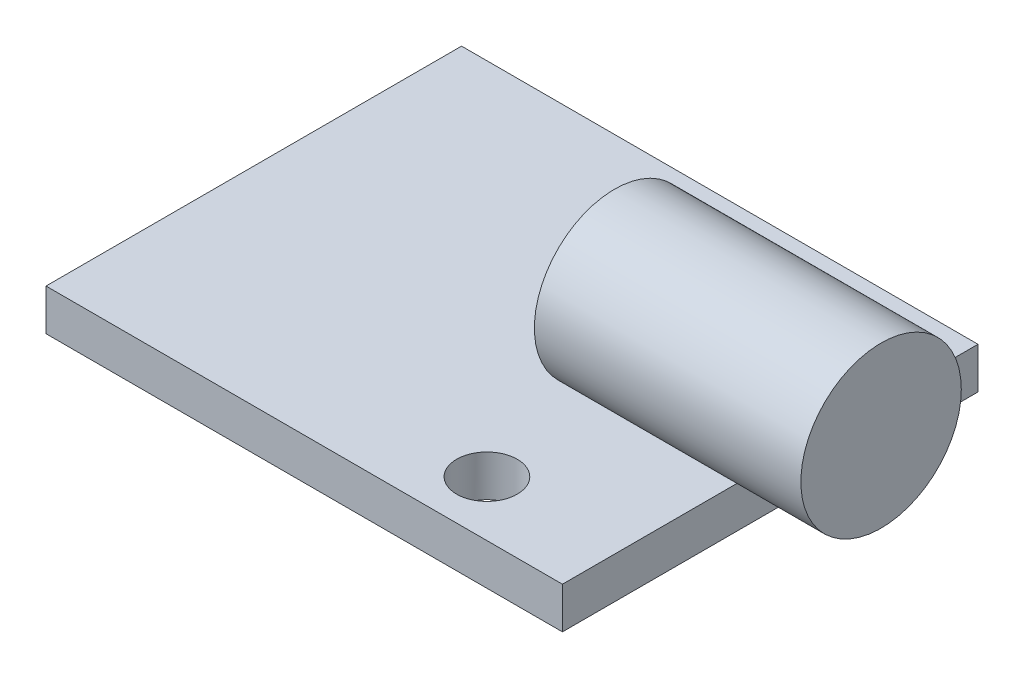
from build123d import *

# Parameters (mm, degrees)
SKETCH1_W                = 19.05
SKETCH1_H                = 15.3289
BOSS_EXTRUDE1_DEPTH      = 1.524
BOSS_EXTRUDE2_DEPTH      = 4.0894
BOSS_EXTRUDE2_DEPTH_BACK = 5.7404
SKETCH3_R                = 2.9591
SKETCH6_R                = 1.1176
CUT_EXTRUDE1_DEPTH       = 4.0894


with BuildPart() as part:
    # Sketch1 → Boss-Extrude1 (new body)
    with BuildSketch(Plane(origin=(0, 0, 0), x_dir=(1, 0, 0), z_dir=(0, 1, 0))):
        with Locations((9.525, -7.66445)):
            Rectangle(SKETCH1_W, SKETCH1_H)
    extrude(amount=BOSS_EXTRUDE1_DEPTH)

    # Sketch6 → Cut-Extrude1 (cut)
    with BuildSketch(Plane(origin=(0, 1.524, 0), x_dir=(1, 0, 0), z_dir=(0, 1, 0))):
        with Locations((14.224, -13.287240698)):
            Circle(SKETCH6_R)
        with Locations((14.224, -2.784340698)):
            Circle(SKETCH6_R)
    extrude(amount=-CUT_EXTRUDE1_DEPTH, mode=Mode.SUBTRACT)


with BuildPart() as body_2:
    # Sketch3 → Boss-Extrude2 (new, two sides: drawn at the far end of the back side and taken through both)
    with BuildSketch(Plane(origin=(19.05, 0, 0), x_dir=(0, 0, -1), z_dir=(1, 0, 0)).offset(-BOSS_EXTRUDE2_DEPTH_BACK)):
        with Locations((-7.66445, 4.4831)):
            Circle(SKETCH3_R)
    extrude(amount=BOSS_EXTRUDE2_DEPTH + BOSS_EXTRUDE2_DEPTH_BACK)


solid = Compound([part.part, body_2.part])
